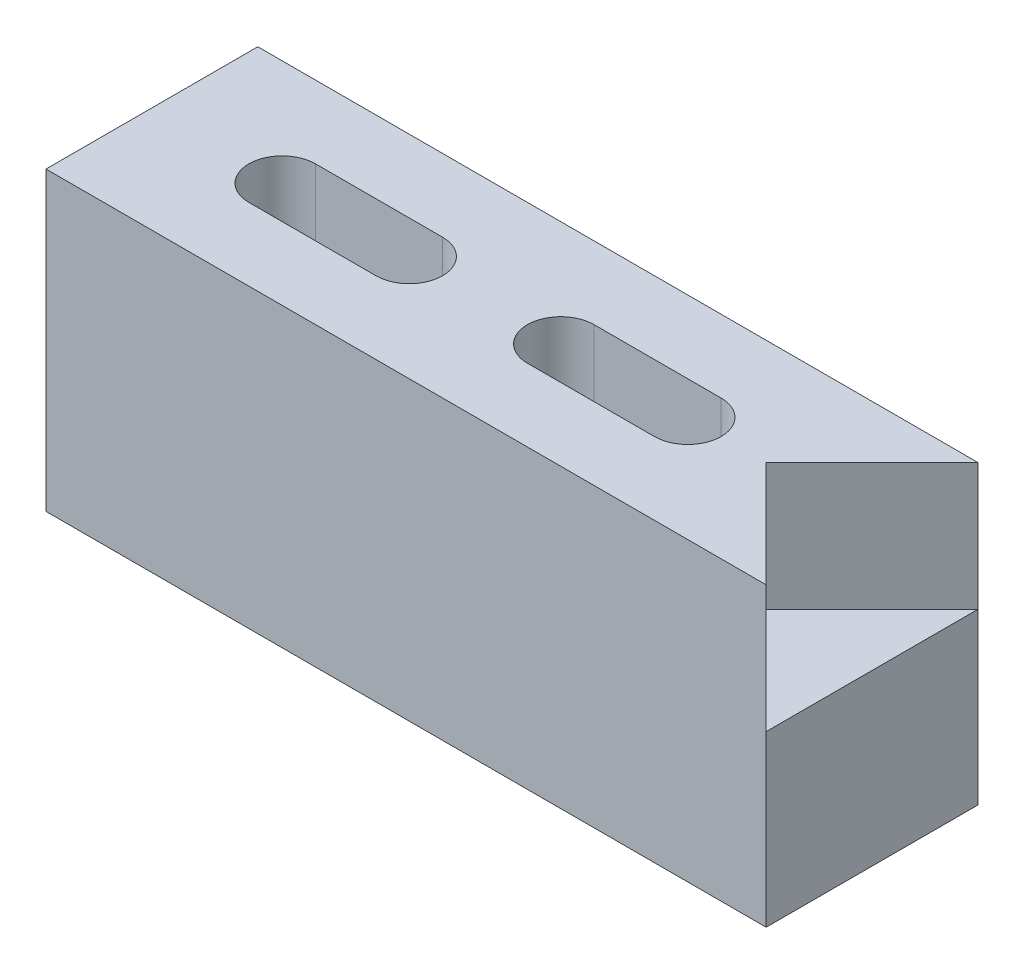
from build123d import *

# Parameters (mm, degrees)
SKETCH1_W           = 43.18
SKETCH1_H           = 17.78
BOSS_EXTRUDE1_DEPTH = 12.7
CUT_EXTRUDE1_DEPTH  = 7.62
CUT_EXTRUDE2_DEPTH  = 49.393499563


with BuildPart() as part:
    # Sketch1 → Boss-Extrude1 (new body)
    with BuildSketch(Plane.XY):
        with Locations((21.59, 8.89)):
            Rectangle(SKETCH1_W, SKETCH1_H)
    extrude(amount=-BOSS_EXTRUDE1_DEPTH)

    # Sketch3 → Cut-Extrude1 (cut)
    with BuildSketch(Plane(origin=(0, 17.78, 0), x_dir=(1, 0, 0), z_dir=(0, 1, 0))):
        Polygon((43.18, 12.7), (36.83, 6.35), (43.18, 0), align=None)
    extrude(amount=-CUT_EXTRUDE1_DEPTH, mode=Mode.SUBTRACT)

    # Sketch4 → Cut-Extrude2 (cut, through all)
    with BuildSketch(Plane(origin=(0, 17.78, 0), x_dir=(1, 0, 0), z_dir=(0, 1, 0))):
        with BuildLine():
            Line((32.131, 4.349999936), (24.511, 4.349999936))
            ThreePointArc((24.511, 4.349999936), (22.510999936, 6.35), (24.511, 8.350000064))
            Line((24.511, 8.350000064), (32.131, 8.350000064))
            ThreePointArc((32.131, 8.350000064), (34.131000064, 6.35), (32.131, 4.349999936))
        make_face()
        with BuildLine():
            Line((15.430999872, 4.349999936), (7.810999872, 4.349999936))
            ThreePointArc((7.810999872, 4.349999936), (5.810999808, 6.35), (7.810999872, 8.350000064))
            Line((7.810999872, 8.350000064), (15.430999872, 8.350000064))
            ThreePointArc((15.430999872, 8.350000064), (17.430999936, 6.35), (15.430999872, 4.349999936))
        make_face()
    extrude(amount=-CUT_EXTRUDE2_DEPTH, mode=Mode.SUBTRACT)


solid = part.part
